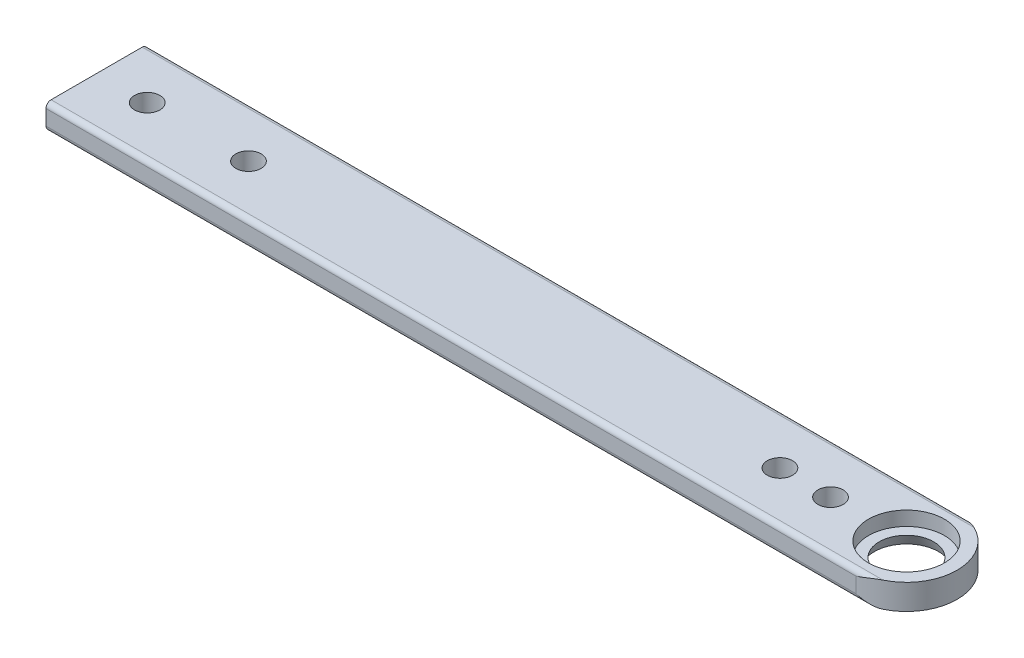
from build123d import *

# Parameters (mm, degrees)
SKETCH1_W           = 215.9
SKETCH1_H           = 25.4
BOSS_EXTRUDE1_DEPTH = 6.35
FILLET1_R           = 1.27
SKETCH2_R           = 3.175
SKETCH2_R_2         = 6.35
CUT_EXTRUDE1_DEPTH  = 109.879819067
SKETCH3_R           = 9.525
CUT_EXTRUDE2_DEPTH  = 3.571875
SKETCH4_R           = 3.175
CUT_EXTRUDE3_DEPTH  = 109.879819067
CUT_EXTRUDE4_DEPTH  = 109.879819067


with BuildPart() as part:
    # Sketch1 → Boss-Extrude1 (new body)
    with BuildSketch(Plane(origin=(0, 0, 0), x_dir=(1, 0, 0), z_dir=(0, 1, 0))):
        Rectangle(SKETCH1_W, SKETCH1_H)
    extrude(amount=BOSS_EXTRUDE1_DEPTH)

    # Fillet1
    fillet1_edges = [part.edges().sort_by_distance(p)[0] for p in [
        (0, 0, -12.7),
        (0, 6.35, -12.7),
        (0, 0, 12.7),
        (0, 6.35, 12.7),
    ]]
    fillet(fillet1_edges, radius=FILLET1_R)

    # Sketch2 → Cut-Extrude1 (cut, through all)
    with BuildSketch(Plane(origin=(0, 6.35, 0), x_dir=(1, 0, 0), z_dir=(0, 1, 0))):
        with Locations((-95.25, 0)):
            Circle(SKETCH2_R)
        with Locations((95.25, 0)):
            Circle(SKETCH2_R_2)
        with Locations((-69.85, 0)):
            Circle(SKETCH2_R)
    extrude(amount=-CUT_EXTRUDE1_DEPTH, mode=Mode.SUBTRACT)

    # Sketch3 → Cut-Extrude2 (cut)
    with BuildSketch(Plane(origin=(0, 6.35, 0), x_dir=(1, 0, 0), z_dir=(0, 1, 0))):
        with Locations((95.25, 0)):
            Circle(SKETCH3_R)
    extrude(amount=-CUT_EXTRUDE2_DEPTH, mode=Mode.SUBTRACT)

    # Sketch4 → Cut-Extrude3 (cut, through all)
    with BuildSketch(Plane(origin=(0, 6.35, 0), x_dir=(1, 0, 0), z_dir=(0, 1, 0))):
        with Locations((76.2, 0)):
            Circle(SKETCH4_R)
        with Locations((63.5, 0)):
            Circle(SKETCH4_R)
    extrude(amount=-CUT_EXTRUDE3_DEPTH, mode=Mode.SUBTRACT)

    # Sketch5 → Cut-Extrude4 (cut, through all)
    with BuildSketch(Plane(origin=(0, 6.35, 0), x_dir=(1, 0, 0), z_dir=(0, 1, 0))):
        with BuildLine():
            Line((95.25, -12.7), (107.95, -12.7))
            Line((107.95, -12.7), (107.95, 0))
            ThreePointArc((107.95, 0), (104.230256121, -8.980256121), (95.25, -12.7))
        make_face()
        with BuildLine():
            Line((107.95, 0), (107.95, 12.7))
            Line((107.95, 12.7), (95.25, 12.7))
            ThreePointArc((95.25, 12.7), (104.230256121, 8.980256121), (107.95, 0))
        make_face()
    extrude(amount=-CUT_EXTRUDE4_DEPTH, mode=Mode.SUBTRACT)

    # Sketch6 → Cut-Revolve2 (revolve, cut)
    with BuildSketch(Plane.ZY.offset(-95.25)):
        Polygon((-8.06821119, 0), (-6.35, 0), (-6.35, 2.778125), (-6.831310248, 2.778125), align=None)
    revolve(axis=Axis((95.25, 0, 0), (0, 1, 0)), mode=Mode.SUBTRACT)


solid = part.part
